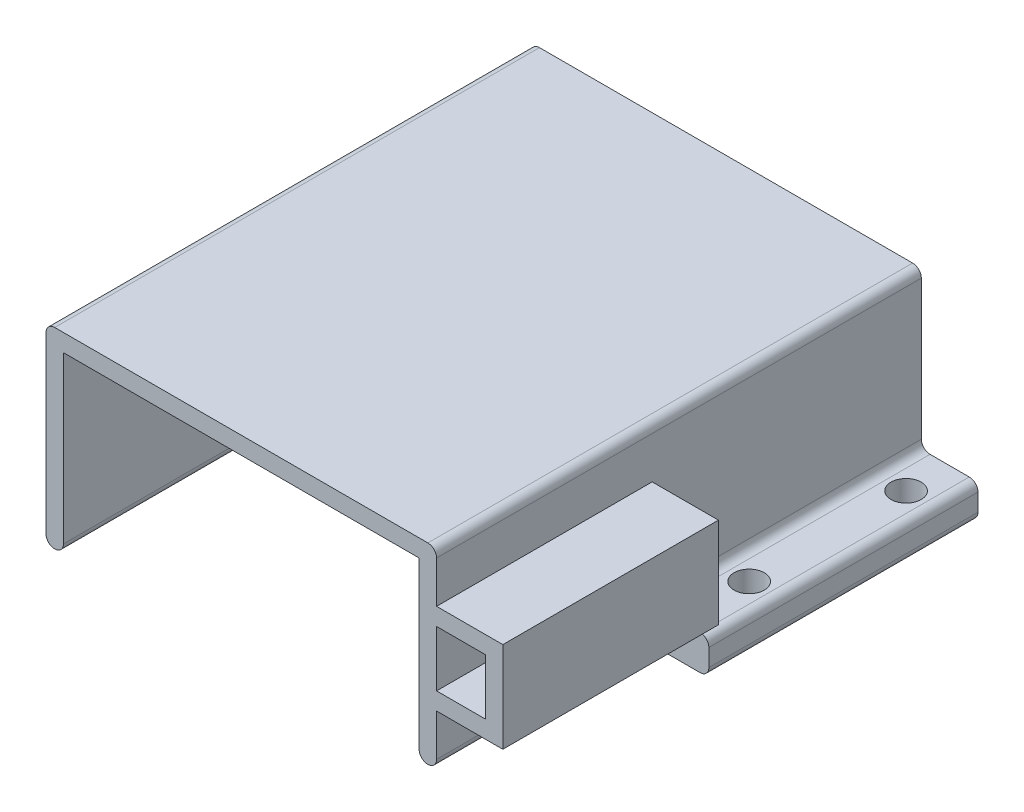
from build123d import *

# Parameters (mm, degrees)
BOSS_EXTRUDE1_DEPTH = 70.612
SKETCH2_R           = 2.2
CUT_EXTRUDE1_DEPTH  = 83.799422419
SKETCH3_W           = 8.255
SKETCH3_H           = 31.401404102
CUT_EXTRUDE2_DEPTH  = 83.799422419
BOSS_EXTRUDE3_DEPTH = 2.54
CUT_EXTRUDE6_DEPTH  = 2.54
SKETCH9_W           = 51.816
SKETCH9_H           = 2.54
CUT_EXTRUDE7_DEPTH  = 2.54
FILLET1_R           = 1.27
FILLET2_R           = 1.27
BOSS_EXTRUDE4_DEPTH = 31.401404102


with BuildPart() as part:
    # Sketch1 → Boss-Extrude1 (new body)
    with BuildSketch(Plane.XY):
        Polygon((25.908, 25.4), (-25.908, 25.4), (-25.908, 0), (-36.703, 0), (-36.703, 5.08), (-28.448, 5.08), (-28.448, 27.94), (28.448, 27.94), (28.448, 5.08), (36.703, 5.08), (36.703, 0), (25.908, 0), align=None)
    extrude(amount=BOSS_EXTRUDE1_DEPTH)

    # Sketch2 → Cut-Extrude1 (cut, through all)
    with BuildSketch(Plane(origin=(0, 5.08, 0), x_dir=(1, 0, 0), z_dir=(0, 1, 0))):
        with Locations(Location((-32.5755, -6.35, 0), (0, 0, 270))):
            Circle(SKETCH2_R)
        with Locations(Location((-32.5755, -29.21, 0), (0, 0, 270))):
            Circle(SKETCH2_R)
    cut_extrude1 = extrude(amount=-CUT_EXTRUDE1_DEPTH, mode=Mode.SUBTRACT)

    # Mirror1: Cut-Extrude1 across plane
    add(cut_extrude1.mirror(Plane(origin=(0, 0, 0), x_dir=(0, 0, 1), z_dir=(1, 0, 0))), mode=Mode.SUBTRACT)

    # Sketch3 → Cut-Extrude2 (cut, through all)
    with BuildSketch(Plane(origin=(0, 5.08, 0), x_dir=(1, 0, 0), z_dir=(0, 1, 0))):
        with Locations((-32.5755, -54.911297949)):
            Rectangle(SKETCH3_W, SKETCH3_H)
        with Locations((32.5755, -54.911297949)):
            Rectangle(SKETCH3_W, SKETCH3_H)
    extrude(amount=-CUT_EXTRUDE2_DEPTH, mode=Mode.SUBTRACT)

    # Sketch6 → Boss-Extrude3 (add)
    with BuildSketch(Plane(origin=(0, 0, 0), x_dir=(-1, 0, 0), z_dir=(0, 0, -1))):
        Polygon((-25.908, 0), (25.908, 0), (36.703, 0), (36.703, 5.08), (28.448, 5.08), (28.448, 27.94), (-28.448, 27.94), (-28.448, 5.08), (-36.703, 5.08), (-36.703, 0), align=None)
    extrude(amount=-BOSS_EXTRUDE3_DEPTH)

    # Sketch8 → Cut-Extrude6 (cut)
    with BuildSketch(Plane(origin=(0, 0, 0), x_dir=(-1, 0, 0), z_dir=(0, 0, -1))):
        with BuildLine():
            Line((-15.875, 0), (15.875, 0))
            ThreePointArc((15.875, 0), (0, 5.572131355), (-15.875, 0))
        make_face()
    extrude(amount=-CUT_EXTRUDE6_DEPTH, mode=Mode.SUBTRACT)

    # Sketch9 → Cut-Extrude7 (cut)
    with BuildSketch(Plane(origin=(0, 0, 0), x_dir=(-1, 0, 0), z_dir=(0, 0, -1))):
        with Locations((0, 1.27)):
            Rectangle(SKETCH9_W, SKETCH9_H)
    extrude(amount=-CUT_EXTRUDE7_DEPTH, mode=Mode.SUBTRACT)

    # Fillet1
    fillet1_edges = [part.edges().sort_by_distance(p)[0] for p in [
        (-28.448, 5.08, 19.605297949),
        (28.448, 5.08, 19.605297949),
        (36.703, 0, 19.605297949),
        (36.703, 5.08, 19.605297949),
        (-36.703, 5.08, 19.605297949),
        (-36.703, 0, 19.605297949),
        (28.448, 0, 54.911297949),
        (25.908, 0, 35.306),
        (-25.908, 0, 35.306),
        (-28.448, 0, 54.911297949),
        (28.448, 27.94, 35.306),
        (-28.448, 27.94, 35.306),
    ]]
    fillet(fillet1_edges, radius=FILLET1_R - 0.0001)  # a hair under: the kernel refuses the full size

    # Fillet2
    fillet2_edges = [part.edges().sort_by_distance(p)[0] for p in [
        (-25.908, 2.54, 1.27),
        (25.908, 2.54, 1.27),
    ]]
    fillet(fillet2_edges, radius=FILLET2_R)

    # Sketch10 → Boss-Extrude4 (add)
    with BuildSketch(Plane.XY.offset(70.612)):
        Polygon((28.448, 20.574), (38.1, 20.574), (38.1, 7.366), (28.448, 7.366), (28.448, 9.906), (35.56, 9.906), (35.56, 18.034), (28.448, 18.034), align=None)
    extrude(amount=-BOSS_EXTRUDE4_DEPTH)


solid = part.part
